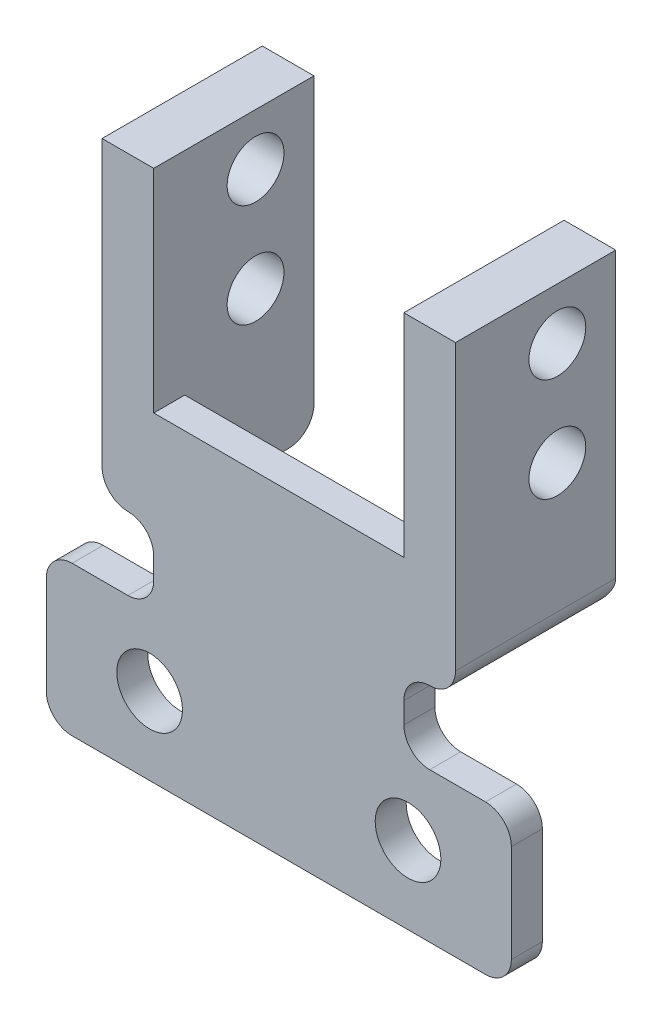
from build123d import *

# Parameters (mm, degrees)
SKETCH1_W                   = 45
SKETCH1_H                   = 14.46
BOSS_EXTRUDE1_DEPTH         = 3
F_1_4_0_25_DIAMETER_HOLE1_D = 6.35
SKETCH5_W                   = 24.2
SKETCH5_H                   = 37.04
BOSS_EXTRUDE2_DEPTH         = 3
SKETCH6_W                   = 15.5
SKETCH6_H                   = 30
BOSS_EXTRUDE3_DEPTH         = 5
BOSS_EXTRUDE4_START         = -29.2
SKETCH7_W                   = 15.5
SKETCH7_H                   = 30
BOSS_EXTRUDE4_DEPTH         = 5
SKETCH12_W                  = 24.2
SKETCH12_H                  = 20.5
CUT_EXTRUDE1_DEPTH          = 3
M5_CLEARANCE_HOLE1_D        = 5.5
FILLET3_R                   = 2.5
FILLET4_R                   = 2.5


with BuildPart() as part:
    # Sketch1 → Boss-Extrude1 (new body)
    with BuildSketch(Plane.XY):
        with Locations((13.988651535, -1.802042724)):
            Rectangle(SKETCH1_W, SKETCH1_H)
    extrude(amount=BOSS_EXTRUDE1_DEPTH)

    # 1/4 (0.25) Diameter Hole1 (through all)
    with Locations(Plane(origin=(0, 0, 0), x_dir=(-1, 0, 0), z_dir=(0, 0, -1))):
        with Locations((-26.488651535, -1.532042724), (-1.488651535, -1.532042724)):
            Hole(F_1_4_0_25_DIAMETER_HOLE1_D / 2)

    # Sketch5 → Boss-Extrude2 (add)
    with BuildSketch(Plane(origin=(0, 0, 0), x_dir=(-1, 0, 0), z_dir=(0, 0, -1))):
        with Locations((-13.988651535, 23.947957276)):
            Rectangle(SKETCH5_W, SKETCH5_H)
    extrude(amount=-BOSS_EXTRUDE2_DEPTH)

    # Sketch6 → Boss-Extrude3 (add)
    with BuildSketch(Plane.ZY.offset(-1.888651535)):
        with Locations((-4.75, 27.467957276)):
            Rectangle(SKETCH6_W, SKETCH6_H)
    extrude(amount=BOSS_EXTRUDE3_DEPTH)

    # Sketch7 → Boss-Extrude4 (add)
    with BuildSketch(Plane.ZY.offset(3.111348465).offset(BOSS_EXTRUDE4_START)):
        with Locations((-4.75, 27.467957276)):
            Rectangle(SKETCH7_W, SKETCH7_H)
    extrude(amount=-BOSS_EXTRUDE4_DEPTH)

    # Sketch12 → Cut-Extrude1 (cut)
    with BuildSketch(Plane(origin=(0, 0, 0), x_dir=(-1, 0, 0), z_dir=(0, 0, -1))):
        with Locations((-13.988651535, 32.217957276)):
            Rectangle(SKETCH12_W, SKETCH12_H)
    extrude(amount=-CUT_EXTRUDE1_DEPTH, mode=Mode.SUBTRACT)

    # M5 Clearance Hole1 (through all)
    with Locations(Plane.ZY.offset(3.111348465)):
        with Locations((-6.85, 37.467957276), (-6.85, 27.467957276)):
            Hole(M5_CLEARANCE_HOLE1_D / 2)

    # Fillet3
    fillet3_edges = [part.edges().sort_by_distance(p)[0] for p in [
        (-8.511348465, 5.427957276, 1.5),
        (36.488651535, 5.427957276, 1.5),
        (36.488651535, -9.032042724, 1.5),
        (-8.511348465, -9.032042724, 1.5),
    ]]
    fillet(fillet3_edges, radius=FILLET3_R)

    # Fillet4
    fillet4_edges = [part.edges().sort_by_distance(p)[0] for p in [
        (1.888651535, 5.427957276, 1.5),
        (26.088651535, 5.427957276, 1.5),
        (26.088651535, 12.467957276, 1.5),
        (1.888651535, 12.467957276, 1.5),
        (31.088651535, 12.467957276, -4.75),
        (-3.111348465, 12.467957276, -4.75),
        (28.588651535, 12.467957276, -12.5),
        (-0.611348465, 12.467957276, -12.5),
    ]]
    fillet(fillet4_edges, radius=FILLET4_R - 0.0001)  # a hair under: the kernel refuses the full size


solid = part.part
